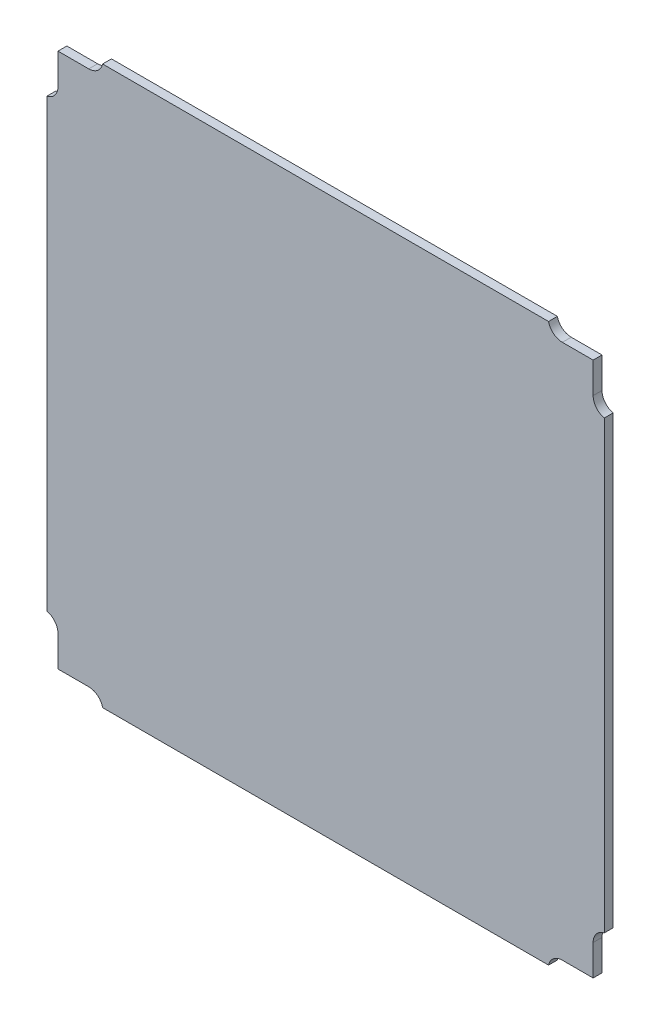
from build123d import *

# Parameters (mm, degrees)
BOSS_EXTRUDE1_DEPTH = 1.5875
FILLET1_R           = 2.54


with BuildPart() as part:
    # Sketch1 → Boss-Extrude1 (new body)
    with BuildSketch(Plane.XY):
        Polygon((40, 50), (-40, 50), (-40, 48), (-48, 48), (-48, 40), (-50, 40), (-50, -37.864895224), (-50, -40), (-48, -40), (-48, -48), (-40, -48), (-40, -50), (-37.864895224, -50), (40, -50), (40, -48), (48, -48), (48, -40), (50, -40), (50, 40), (48, 40), (48, 48), (40, 48), align=None)
    extrude(amount=BOSS_EXTRUDE1_DEPTH)

    # Fillet1
    # the kernel refuses this fillet: 2.54 mm, written as the material it adds along each edge
    with BuildSketch(Plane(origin=(-48, -40, 0), x_dir=(0, -1, 0), z_dir=(0, 0, 1)), Plane(origin=(40, -48, 0), x_dir=(1, 0, 0), z_dir=(0, 0, 1)), Plane(origin=(48, 40, 0), x_dir=(0, 1, 0), z_dir=(0, 0, 1)), Plane(origin=(-40, 48, 0), x_dir=(-1, 0, 0), z_dir=(0, 0, 1))) as fillet1_piece_1:
        with BuildLine():
            CenterArc((2.481934729, -2.54), FILLET1_R, 90, 77.725329785)
            Line((0, -2), (-0.049638695, -1.9892))
            ThreePointArc((-0.049638695, -1.9892), (-0.0508, -1), (-0.0508, 0))
            Line((-0.0508, 0), (0, 0.0508))
            Line((0, 0.0508), (2.481934729, 0.0508))
            Line((2.481934729, 0.0508), (2.481934729, 0))
        make_face()
    extrude(amount=1.5875)
    with BuildSketch(Plane(origin=(-40, -48, 0), x_dir=(-3.737454790095179e-12, -1.0, 0), z_dir=(0, 0, 1)), Plane(origin=(48, -40, 0), x_dir=(1.0, -3.7339020764163554e-12, 0), z_dir=(0, 0, 1)), Plane(origin=(-48, 40, 0), x_dir=(-1.0, 3.737454790095126e-12, 0), z_dir=(0, 0, 1))) as fillet1_piece_2:
        with BuildLine():
            CenterArc((2.54, -2.481934729), FILLET1_R, 102.274670215, 77.725329785)
            Line((0, -2.481934729), (-0.0508, -2.481934729))
            Line((-0.0508, -2.481934729), (-0.0508, 0))
            Line((-0.0508, 0), (0, 0.0508))
            ThreePointArc((0, 0.0508), (1, 0.0508), (1.9892, 0.049638695))
            Line((1.9892, 0.049638695), (2, 0))
        make_face()
    extrude(amount=1.5875)
    with BuildSketch(Plane(origin=(40, 48, 0), x_dir=(1, 0, 0), z_dir=(0, 0, 1))) as fillet1_piece_3:
        with BuildLine():
            CenterArc((2.481934729, 2.54), FILLET1_R, 192.274670215, 77.725329785)
            Line((0, 2), (-0.049638695, 1.9892))
            ThreePointArc((-0.049638695, 1.9892), (-0.0508, 1), (-0.0508, 0))
            Line((-0.0508, 0), (0, -0.0508))
            Line((0, -0.0508), (2.481934729, -0.0508))
            Line((2.481934729, -0.0508), (2.481934729, 0))
        make_face()
    extrude(amount=1.5875)


solid = part.part
